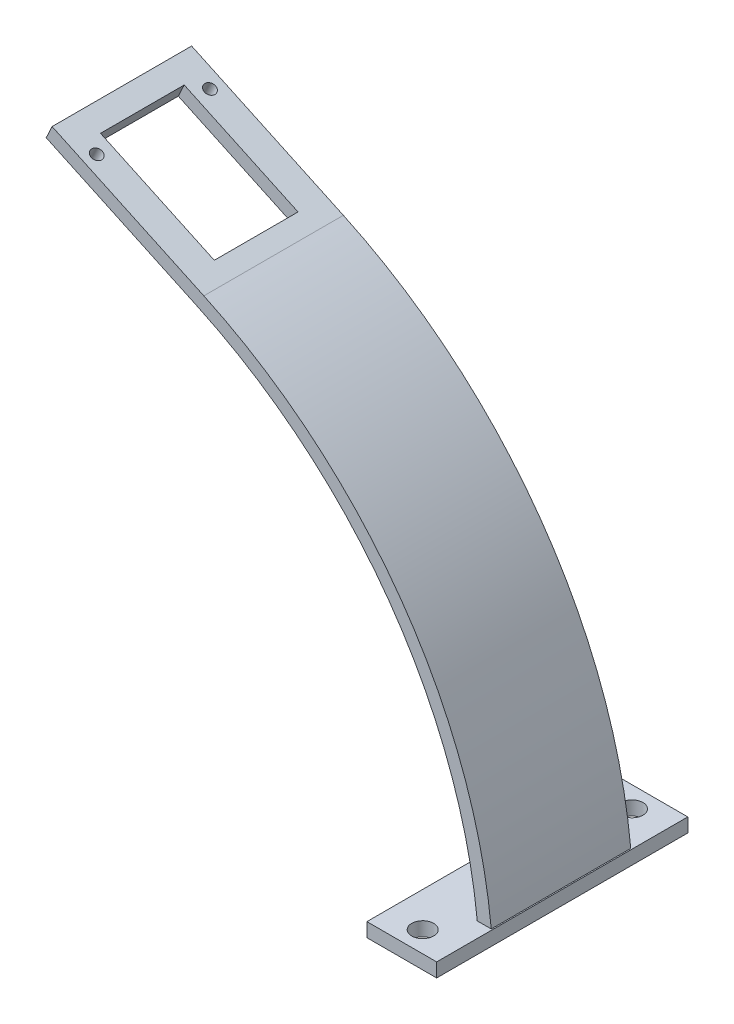
from build123d import *

# Parameters (mm, degrees)
BOSS_EXTRUDE1_DEPTH = 25.4
CUT_EXTRUDE1_REACH  = 113.898
SKETCH2_R           = 0.99949
SKETCH2_W           = 22.86
SKETCH2_H           = 15.24
SKETCH3_W           = 12.7
SKETCH3_H           = 45.72
SKETCH3_R           = 2
BOSS_EXTRUDE2_DEPTH = 2.54


with BuildPart() as part:
    # Sketch1 → Boss-Extrude1 (new body)
    with BuildSketch(Plane.XY):
        with BuildLine():
            Line((-51.078455101, 73.897978221), (-78.70271645, 86.779382839))
            Line((-78.70271645, 86.779382839), (-77.629266065, 89.081404618))
            Line((-77.629266065, 89.081404618), (-50.005004716, 76.2))
            ThreePointArc((-50.005004716, 76.2), (-13.376985713, 45.240822454), (2.54, 0))
            Line((2.54, 0), (0, 0))
            ThreePointArc((0, 0), (-15.518522123, 43.8753241), (-51.078455101, 73.897978221))
        make_face()
    extrude(amount=BOSS_EXTRUDE1_DEPTH)

    # Sketch2 → Cut-Extrude1 (cut, up to next)
    with BuildSketch(Plane(origin=(20.255089652, 43.437179933, 0), x_dir=(0.9063077870366493, -0.4226182617407013, 0), z_dir=(0.4226182617407013, 0.9063077870366493, 0)), mode=Mode.PRIVATE) as cut_extrude1_sk1:
        with Locations((-101.65343671, -2.41681)):
            Circle(SKETCH2_R)
    cut_extrude1_tool1 = extrude(cut_extrude1_sk1.sketch, amount=-CUT_EXTRUDE1_REACH, mode=Mode.PRIVATE) & part.part
    # Sketch2 → Cut-Extrude1 (cut, up to next)
    with BuildSketch(Plane(origin=(20.255089652, 43.437179933, 0), x_dir=(0.9063077870366493, -0.4226182617407013, 0), z_dir=(0.4226182617407013, 0.9063077870366493, 0)), mode=Mode.PRIVATE) as cut_extrude1_sk2:
        with Locations((-101.65343671, -23.03399)):
            Circle(SKETCH2_R)
    cut_extrude1_tool2 = extrude(cut_extrude1_sk2.sketch, amount=-CUT_EXTRUDE1_REACH, mode=Mode.PRIVATE) & part.part
    # Sketch2 → Cut-Extrude1 (cut, up to next)
    with BuildSketch(Plane(origin=(20.255089652, 43.437179933, 0), x_dir=(0.9063077870366493, -0.4226182617407013, 0), z_dir=(0.4226182617407013, 0.9063077870366493, 0)), mode=Mode.PRIVATE) as cut_extrude1_sk3:
        with Locations((-92.45863671, -12.7)):
            Rectangle(SKETCH2_W, SKETCH2_H)
    cut_extrude1_tool3 = extrude(cut_extrude1_sk3.sketch, amount=-CUT_EXTRUDE1_REACH, mode=Mode.PRIVATE) & part.part
    add(cut_extrude1_tool1.solids().sort_by_distance((-71.874212, 86.397779, 2.41681))[0], mode=Mode.SUBTRACT)
    add(cut_extrude1_tool2.solids().sort_by_distance((-71.874212, 86.397779, 23.03399))[0], mode=Mode.SUBTRACT)
    add(cut_extrude1_tool3.solids().sort_by_distance((-63.540893, 82.511888, 12.7))[0], mode=Mode.SUBTRACT)

    # Sketch3 → Boss-Extrude2 (add)
    with BuildSketch(Plane(origin=(0, 0, 0), x_dir=(1, 0, 0), z_dir=(0, 1, 0))):
        with Locations((-3.81, -12.7)):
            Rectangle(SKETCH3_W, SKETCH3_H)
        with Locations((-3.81, 6.35)):
            Circle(SKETCH3_R, mode=Mode.SUBTRACT)
        with Locations((-3.81, -31.75)):
            Circle(SKETCH3_R, mode=Mode.SUBTRACT)
    extrude(amount=BOSS_EXTRUDE2_DEPTH)


solid = part.part
